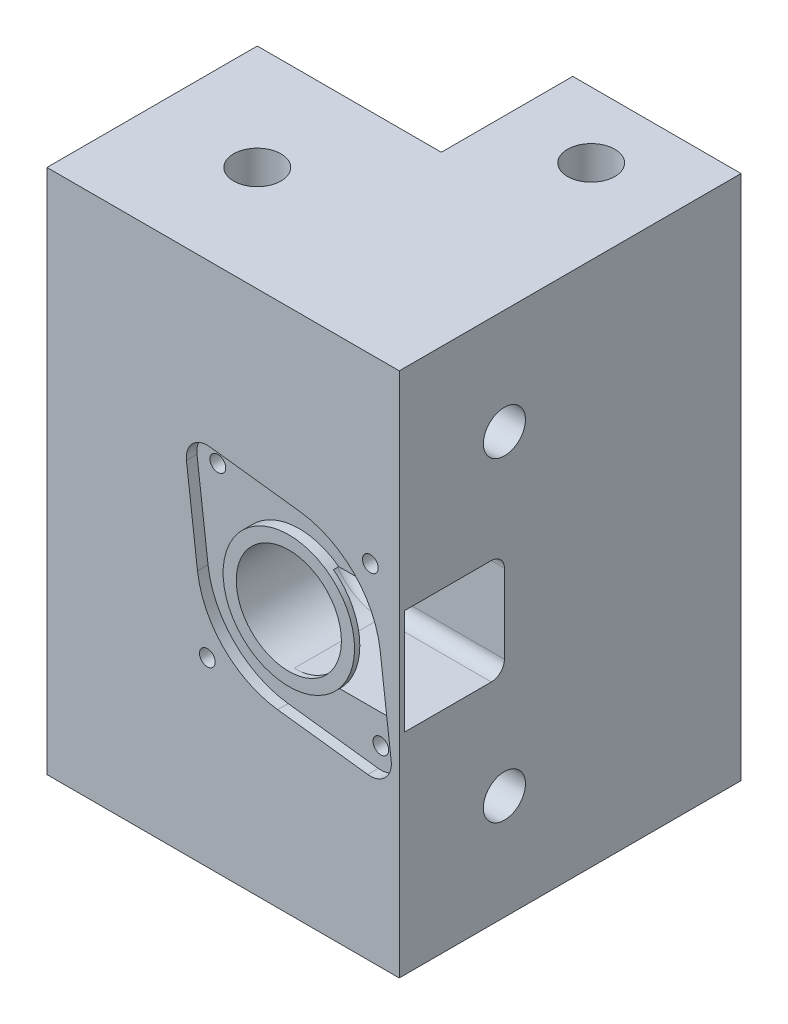
from build123d import *

# Parameters (mm, degrees)
SKETCH1_R                               = 4.5
BOSS_EXTRUDE1_DEPTH                     = 100
CBORE_FOR_M5_HEX_HEAD_BOLT2_D           = 13.5
CBORE_FOR_M5_HEX_HEAD_BOLT2_DEPTH       = 23.85
CBORE_FOR_M5_HEX_HEAD_BOLT2_CBORE_D     = 32
CBORE_FOR_M5_HEX_HEAD_BOLT2_CBORE_DEPTH = 5
CBORE_FOR_M5_HEX_HEAD_BOLT3_D           = 10.2
CBORE_FOR_M5_HEX_HEAD_BOLT3_DEPTH       = 13.5
CBORE_FOR_M5_HEX_HEAD_BOLT3_CBORE_D     = 22
CBORE_FOR_M5_HEX_HEAD_BOLT3_CBORE_DEPTH = 3.5
SKETCH8_R                               = 4
CUT_EXTRUDE1_DEPTH                      = 27
SKETCH9_R                               = 1.5
CUT_EXTRUDE2_DEPTH                      = 119
SKETCH10_R                              = 10
CUT_EXTRUDE3_DEPTH                      = 20
SKETCH11_W                              = 19
SKETCH11_H                              = 20
CUT_EXTRUDE4_DEPTH                      = 21
FILLET2_R                               = 2.5
CUT_EXTRUDE8_REACH                      = 131.298
CUT_EXTRUDE8_START                      = -5
SKETCH13_R                              = 3
SKETCH15_R                              = 12.5
CUT_EXTRUDE9_DEPTH                      = 2


with BuildPart() as part:
    # Sketch1 → Boss-Extrude1 (new body)
    with BuildSketch(Plane(origin=(0, 0, 0), x_dir=(1, 0, 0), z_dir=(0, 1, 0))):
        Polygon((-35, 0), (0, 0), (0, 25), (32, 25), (32, -40), (-35, -40), align=None)
        with Locations((-15, -20)):
            Circle(SKETCH1_R, mode=Mode.SUBTRACT)
        with Locations((16, 12.5)):
            Circle(SKETCH1_R, mode=Mode.SUBTRACT)
    extrude(amount=BOSS_EXTRUDE1_DEPTH)

    # CBORE for M5 Hex Head Bolt2
    with Locations(Plane(origin=(0, 0, 0), x_dir=(-1, 0, 0), z_dir=(0, -1, 0))):
        with Locations((15, -20)):
            CounterBoreHole(CBORE_FOR_M5_HEX_HEAD_BOLT2_D / 2, CBORE_FOR_M5_HEX_HEAD_BOLT2_CBORE_D / 2, CBORE_FOR_M5_HEX_HEAD_BOLT2_CBORE_DEPTH, depth=CBORE_FOR_M5_HEX_HEAD_BOLT2_DEPTH)

    # CBORE for M5 Hex Head Bolt3
    with Locations(Plane(origin=(0, 0, 0), x_dir=(-1, 0, 0), z_dir=(0, -1, 0))):
        with Locations((-16, 12.5)):
            CounterBoreHole(CBORE_FOR_M5_HEX_HEAD_BOLT3_D / 2, CBORE_FOR_M5_HEX_HEAD_BOLT3_CBORE_D / 2, CBORE_FOR_M5_HEX_HEAD_BOLT3_CBORE_DEPTH, depth=CBORE_FOR_M5_HEX_HEAD_BOLT3_DEPTH)

    # Sketch8 → Cut-Extrude1 (cut)
    with BuildSketch(Plane(origin=(32, 0, 0), x_dir=(0, 0, -1), z_dir=(1, 0, 0))):
        with Locations((-20, 80)):
            Circle(SKETCH8_R)
        with Locations((-20, 20)):
            Circle(SKETCH8_R)
    extrude(amount=-CUT_EXTRUDE1_DEPTH, mode=Mode.SUBTRACT)

    # Sketch9 → Cut-Extrude2 (cut)
    with BuildSketch(Plane.XY.offset(40)):
        with Locations((-4.5, 65.5)):
            Circle(SKETCH9_R)
        with Locations((26.5, 65.5)):
            Circle(SKETCH9_R)
        with Locations((26.5, 34.5)):
            Circle(SKETCH9_R)
        with Locations((-4.5, 34.5)):
            Circle(SKETCH9_R)
    extrude(amount=-CUT_EXTRUDE2_DEPTH, mode=Mode.SUBTRACT)

    # Sketch10 → Cut-Extrude3 (cut)
    with BuildSketch(Plane.XY.offset(40)):
        with Locations((11, 50)):
            Circle(SKETCH10_R)
    extrude(amount=-CUT_EXTRUDE3_DEPTH, mode=Mode.SUBTRACT)

    # Sketch11 → Cut-Extrude4 (cut)
    with BuildSketch(Plane(origin=(32, 0, 0), x_dir=(0, 0, -1), z_dir=(1, 0, 0))):
        with Locations((-29.5, 50)):
            Rectangle(SKETCH11_W, SKETCH11_H)
    extrude(amount=-CUT_EXTRUDE4_DEPTH, mode=Mode.SUBTRACT)

    # Fillet2
    fillet2_edges = [part.edges().sort_by_distance(p)[0] for p in [
        (21.5, 40, 20),
        (1, 50, 20),
        (21.5, 60, 20),
    ]]
    fillet(fillet2_edges, radius=FILLET2_R)

    # Sketch13 → Cut-Extrude8 (cut, up to next)
    with BuildSketch(Plane.XY.offset(40).offset(CUT_EXTRUDE8_START), mode=Mode.PRIVATE) as cut_extrude8_sk1:
        with Locations((-4.5, 65.5)):
            Circle(SKETCH13_R)
    cut_extrude8_tool1 = extrude(cut_extrude8_sk1.sketch, amount=-CUT_EXTRUDE8_REACH, mode=Mode.PRIVATE) & part.part
    # Sketch13 → Cut-Extrude8 (cut, up to next)
    with BuildSketch(Plane.XY.offset(40).offset(CUT_EXTRUDE8_START), mode=Mode.PRIVATE) as cut_extrude8_sk2:
        with Locations((26.5, 65.5)):
            Circle(SKETCH13_R)
    cut_extrude8_tool2 = extrude(cut_extrude8_sk2.sketch, amount=-CUT_EXTRUDE8_REACH, mode=Mode.PRIVATE) & part.part
    # Sketch13 → Cut-Extrude8 (cut, up to next)
    with BuildSketch(Plane.XY.offset(40).offset(CUT_EXTRUDE8_START), mode=Mode.PRIVATE) as cut_extrude8_sk3:
        with Locations((26.5, 34.5)):
            Circle(SKETCH13_R)
    cut_extrude8_tool3 = extrude(cut_extrude8_sk3.sketch, amount=-CUT_EXTRUDE8_REACH, mode=Mode.PRIVATE) & part.part
    # Sketch13 → Cut-Extrude8 (cut, up to next)
    with BuildSketch(Plane.XY.offset(40).offset(CUT_EXTRUDE8_START), mode=Mode.PRIVATE) as cut_extrude8_sk4:
        with Locations((-4.5, 34.5)):
            Circle(SKETCH13_R)
    cut_extrude8_tool4 = extrude(cut_extrude8_sk4.sketch, amount=-CUT_EXTRUDE8_REACH, mode=Mode.PRIVATE) & part.part
    add(cut_extrude8_tool1.solids().sort_by_distance((-4.5, 65.5, 35))[0], mode=Mode.SUBTRACT)
    add(cut_extrude8_tool2.solids().sort_by_distance((26.5, 65.5, 35))[0], mode=Mode.SUBTRACT)
    add(cut_extrude8_tool3.solids().sort_by_distance((26.5, 34.5, 35))[0], mode=Mode.SUBTRACT)
    add(cut_extrude8_tool4.solids().sort_by_distance((-4.5, 34.5, 35))[0], mode=Mode.SUBTRACT)

    # Sketch15 → Cut-Extrude9 (cut)
    with BuildSketch(Plane.XY.offset(40)):
        with BuildLine():
            Line((30.470311747, 34.986440779), (28.370113893, 52.128178409))
            ThreePointArc((28.370113893, 52.128178409), (23.374452417, 62.374284924), (13.128413522, 67.370085085))
            Line((13.128413522, 67.370085085), (-4.013773875, 69.470573556))
            ThreePointArc((-4.013773875, 69.470573556), (-7.328695519, 68.328695519), (-8.470573556, 65.013773874))
            Line((-8.470573556, 65.013773874), (-6.370113893, 47.871821591))
            ThreePointArc((-6.370113893, 47.871821591), (-1.374368671, 37.625631329), (8.871821591, 32.629886107))
            Line((8.871821591, 32.629886107), (26.013559221, 30.529688253))
            ThreePointArc((26.013559221, 30.529688253), (29.328427125, 31.671572875), (30.470311747, 34.986440779))
        make_face()
        with Locations((11, 50)):
            Circle(SKETCH15_R, mode=Mode.SUBTRACT)
    extrude(amount=-CUT_EXTRUDE9_DEPTH, mode=Mode.SUBTRACT)


solid = part.part
